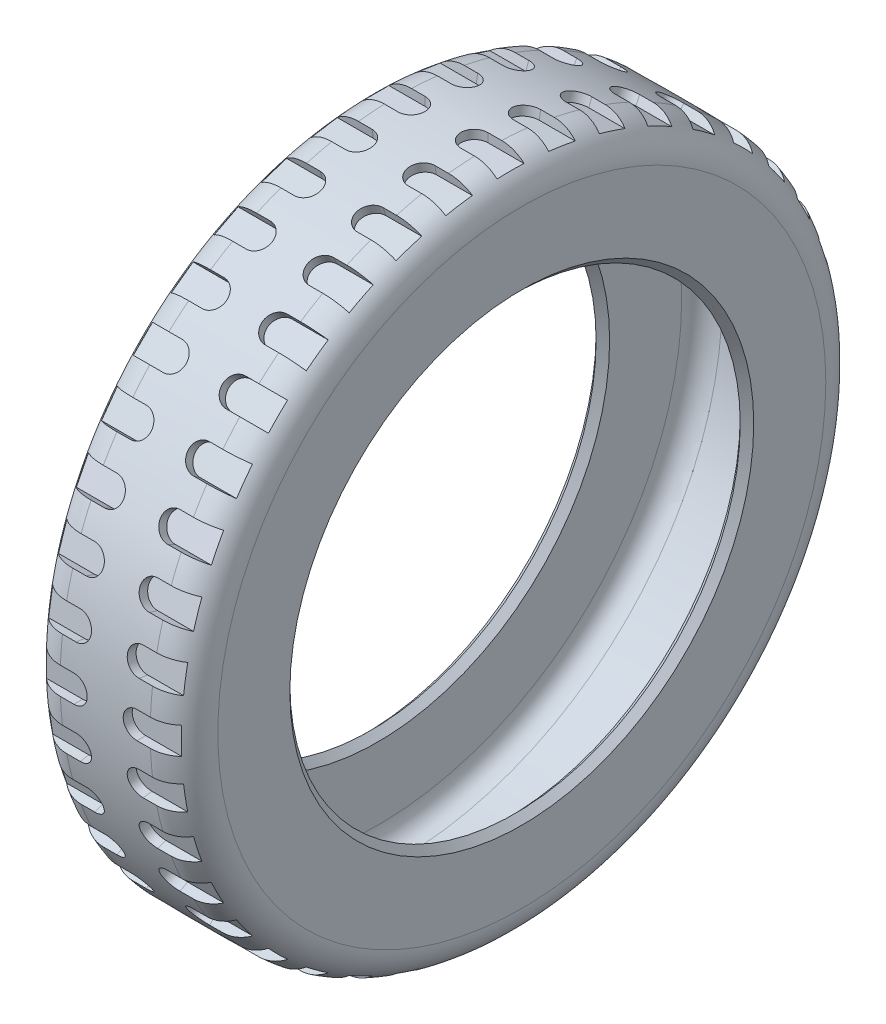
from build123d import *

# Parameters (mm, degrees)
CHAMFER1_SIZE         = 1.5
CUT_EXTRUDE1_DEPTH    = 2
CIRPATTERN1_COUNT     = 40
MIRROR1_COPY_1_DEPTH  = 2
MIRROR1_COPY_2_DEPTH  = 2
MIRROR1_COPY_3_DEPTH  = 2
MIRROR1_COPY_4_DEPTH  = 2
MIRROR1_COPY_5_DEPTH  = 2
MIRROR1_COPY_6_DEPTH  = 2
MIRROR1_COPY_7_DEPTH  = 2
MIRROR1_COPY_8_DEPTH  = 2
MIRROR1_COPY_9_DEPTH  = 2
MIRROR1_COPY_10_DEPTH = 2
MIRROR1_COPY_11_DEPTH = 2
MIRROR1_COPY_12_DEPTH = 2
MIRROR1_COPY_13_DEPTH = 2
MIRROR1_COPY_14_DEPTH = 2
MIRROR1_COPY_15_DEPTH = 2
MIRROR1_COPY_16_DEPTH = 2
MIRROR1_COPY_17_DEPTH = 2
MIRROR1_COPY_18_DEPTH = 2
MIRROR1_COPY_19_DEPTH = 2
MIRROR1_COPY_20_DEPTH = 2
MIRROR1_COPY_21_DEPTH = 2
MIRROR1_COPY_22_DEPTH = 2
MIRROR1_COPY_23_DEPTH = 2
MIRROR1_COPY_24_DEPTH = 2
MIRROR1_COPY_25_DEPTH = 2
MIRROR1_COPY_26_DEPTH = 2
MIRROR1_COPY_27_DEPTH = 2
MIRROR1_COPY_28_DEPTH = 2
MIRROR1_COPY_29_DEPTH = 2
MIRROR1_COPY_30_DEPTH = 2
MIRROR1_COPY_31_DEPTH = 2
MIRROR1_COPY_32_DEPTH = 2
MIRROR1_COPY_33_DEPTH = 2
MIRROR1_COPY_34_DEPTH = 2
MIRROR1_COPY_35_DEPTH = 2
MIRROR1_COPY_36_DEPTH = 2
MIRROR1_COPY_37_DEPTH = 2
MIRROR1_COPY_38_DEPTH = 2
MIRROR1_COPY_39_DEPTH = 2


with BuildPart() as part:
    # Sketch1 → Revolve1 (revolve)
    with BuildSketch(Plane.XY, mode=Mode.PRIVATE) as revolve1_sk:
        with BuildLine():
            Line((-14.5, 50), (-14.5, 67.5))
            ThreePointArc((-14.5, 67.5), (-13.181980515, 70.681980515), (-10, 72))
            Line((-10, 72), (10, 72))
            ThreePointArc((10, 72), (13.181980515, 70.681980515), (14.5, 67.5))
            Line((14.5, 67.5), (14.5, 50))
            Line((14.5, 50), (17.5, 50))
            Line((17.5, 50), (17.5, 67.5))
            ThreePointArc((17.5, 67.5), (15.303300859, 72.803300859), (10, 75))
            Line((10, 75), (-10, 75))
            ThreePointArc((-10, 75), (-15.303300859, 72.803300859), (-17.5, 67.5))
            Line((-17.5, 67.5), (-17.5, 50))
            Line((-17.5, 50), (-14.5, 50))
        make_face()
    revolve(revolve1_sk.sketch.rotate(Axis((0, 0, 0), (-1, 0, 0)), 90), axis=Axis((0, 0, 0), (-1, 0, 0)))

    # Chamfer1
    chamfer1_edges = [part.edges().sort_by_distance(p)[0] for p in [
        (14.5, 0, 50),
        (17.5, 0, 50),
        (-17.5, 0, 50),
        (-14.5, 0, 50),
    ]]
    chamfer(chamfer1_edges, length=CHAMFER1_SIZE - 0.0001)  # a hair under: the kernel refuses the full size

    # Sketch3 → Cut-Extrude1 (cut)
    with BuildSketch(Plane.XY.offset(75)):
        with BuildLine():
            Line((7, 3), (15, 3))
            Line((15, 3), (15, -3))
            Line((15, -3), (7, -3))
            ThreePointArc((7, -3), (4, 0), (7, 3))
        make_face()
    cut_extrude1 = extrude(amount=-CUT_EXTRUDE1_DEPTH, mode=Mode.SUBTRACT)

    # CirPattern1: Cut-Extrude1 ×40 about axis
    cirpattern1_axis = Axis((0, 0, 0), (1, 0, 0))
    for i in range(1, CIRPATTERN1_COUNT):
        add(cut_extrude1.rotate(cirpattern1_axis, i * 360 / CIRPATTERN1_COUNT), mode=Mode.SUBTRACT)

    # Mirror1: Cut-Extrude1 across plane
    add(cut_extrude1.mirror(Plane(origin=(0, 0, 0), x_dir=(0, 0, 1), z_dir=(1, 0, 0))), mode=Mode.SUBTRACT)

    # Mirror1 copy 1 sketch → Mirror1 copy 1 (cut)
    with BuildSketch(Plane(origin=(0, -11.732584878, 74.076625545), x_dir=(-1, 0, 0), z_dir=(0, -0.15643446504023087, 0.9876883405951378))):
        with BuildLine():
            Line((7, -3), (15, -3))
            Line((15, -3), (15, 3))
            Line((15, 3), (7, 3))
            ThreePointArc((7, 3), (4, 0), (7, -3))
        make_face()
    extrude(amount=-MIRROR1_COPY_1_DEPTH, mode=Mode.SUBTRACT)

    # Mirror1 copy 2 sketch → Mirror1 copy 2 (cut)
    with BuildSketch(Plane(origin=(0, -23.176274578, 71.329238722), x_dir=(-1, 0, 0), z_dir=(0, -0.3090169943749474, 0.9510565162951535))):
        with BuildLine():
            Line((7, -3), (15, -3))
            Line((15, -3), (15, 3))
            Line((15, 3), (7, 3))
            ThreePointArc((7, 3), (4, 0), (7, -3))
        make_face()
    extrude(amount=-MIRROR1_COPY_2_DEPTH, mode=Mode.SUBTRACT)

    # Mirror1 copy 3 sketch → Mirror1 copy 3 (cut)
    with BuildSketch(Plane(origin=(0, -34.04928748, 66.825489314), x_dir=(-1, 0, 0), z_dir=(0, -0.45399049973954675, 0.8910065241883679))):
        with BuildLine():
            Line((7, -3), (15, -3))
            Line((15, -3), (15, 3))
            Line((15, 3), (7, 3))
            ThreePointArc((7, 3), (4, 0), (7, -3))
        make_face()
    extrude(amount=-MIRROR1_COPY_3_DEPTH, mode=Mode.SUBTRACT)

    # Mirror1 copy 4 sketch → Mirror1 copy 4 (cut)
    with BuildSketch(Plane(origin=(0, -44.083893922, 60.676274578), x_dir=(-1, 0, 0), z_dir=(0, -0.5877852522924731, 0.8090169943749475))):
        with BuildLine():
            Line((7, -3), (15, -3))
            Line((15, -3), (15, 3))
            Line((15, 3), (7, 3))
            ThreePointArc((7, 3), (4, 0), (7, -3))
        make_face()
    extrude(amount=-MIRROR1_COPY_4_DEPTH, mode=Mode.SUBTRACT)

    # Mirror1 copy 5 sketch → Mirror1 copy 5 (cut)
    with BuildSketch(Plane(origin=(0, -53.033008589, 53.033008589), x_dir=(-1, 0, 0), z_dir=(0, -0.7071067811865475, 0.7071067811865476))):
        with BuildLine():
            Line((7, -3), (15, -3))
            Line((15, -3), (15, 3))
            Line((15, 3), (7, 3))
            ThreePointArc((7, 3), (4, 0), (7, -3))
        make_face()
    extrude(amount=-MIRROR1_COPY_5_DEPTH, mode=Mode.SUBTRACT)

    # Mirror1 copy 6 sketch → Mirror1 copy 6 (cut)
    with BuildSketch(Plane(origin=(0, -60.676274578, 44.083893922), x_dir=(-1, 0, 0), z_dir=(0, -0.8090169943749475, 0.5877852522924731))):
        with BuildLine():
            Line((7, -3), (15, -3))
            Line((15, -3), (15, 3))
            Line((15, 3), (7, 3))
            ThreePointArc((7, 3), (4, 0), (7, -3))
        make_face()
    extrude(amount=-MIRROR1_COPY_6_DEPTH, mode=Mode.SUBTRACT)

    # Mirror1 copy 7 sketch → Mirror1 copy 7 (cut)
    with BuildSketch(Plane(origin=(0, -66.825489314, 34.04928748), x_dir=(-1, 0, 0), z_dir=(0, -0.8910065241883678, 0.4539904997395468))):
        with BuildLine():
            Line((7, -3), (15, -3))
            Line((15, -3), (15, 3))
            Line((15, 3), (7, 3))
            ThreePointArc((7, 3), (4, 0), (7, -3))
        make_face()
    extrude(amount=-MIRROR1_COPY_7_DEPTH, mode=Mode.SUBTRACT)

    # Mirror1 copy 8 sketch → Mirror1 copy 8 (cut)
    with BuildSketch(Plane(origin=(0, -71.329238722, 23.176274578), x_dir=(-1, 0, 0), z_dir=(0, -0.9510565162951535, 0.30901699437494745))):
        with BuildLine():
            Line((7, -3), (15, -3))
            Line((15, -3), (15, 3))
            Line((15, 3), (7, 3))
            ThreePointArc((7, 3), (4, 0), (7, -3))
        make_face()
    extrude(amount=-MIRROR1_COPY_8_DEPTH, mode=Mode.SUBTRACT)

    # Mirror1 copy 9 sketch → Mirror1 copy 9 (cut)
    with BuildSketch(Plane(origin=(0, -74.076625545, 11.732584878), x_dir=(-1, 0, 0), z_dir=(0, -0.9876883405951378, 0.15643446504023092))):
        with BuildLine():
            Line((7, -3), (15, -3))
            Line((15, -3), (15, 3))
            Line((15, 3), (7, 3))
            ThreePointArc((7, 3), (4, 0), (7, -3))
        make_face()
    extrude(amount=-MIRROR1_COPY_9_DEPTH, mode=Mode.SUBTRACT)

    # Mirror1 copy 10 sketch → Mirror1 copy 10 (cut)
    with BuildSketch(Plane(origin=(0, -75, 0), x_dir=(-1, 0, 0), z_dir=(0, -1, 0))):
        with BuildLine():
            Line((7, -3), (15, -3))
            Line((15, -3), (15, 3))
            Line((15, 3), (7, 3))
            ThreePointArc((7, 3), (4, 0), (7, -3))
        make_face()
    extrude(amount=-MIRROR1_COPY_10_DEPTH, mode=Mode.SUBTRACT)

    # Mirror1 copy 11 sketch → Mirror1 copy 11 (cut)
    with BuildSketch(Plane(origin=(0, -74.076625545, -11.732584878), x_dir=(-1, 0, 0), z_dir=(0, -0.9876883405951378, -0.1564344650402308))):
        with BuildLine():
            Line((7, -3), (15, -3))
            Line((15, -3), (15, 3))
            Line((15, 3), (7, 3))
            ThreePointArc((7, 3), (4, 0), (7, -3))
        make_face()
    extrude(amount=-MIRROR1_COPY_11_DEPTH, mode=Mode.SUBTRACT)

    # Mirror1 copy 12 sketch → Mirror1 copy 12 (cut)
    with BuildSketch(Plane(origin=(0, -71.329238722, -23.176274578), x_dir=(-1, 0, 0), z_dir=(0, -0.9510565162951536, -0.30901699437494734))):
        with BuildLine():
            Line((7, -3), (15, -3))
            Line((15, -3), (15, 3))
            Line((15, 3), (7, 3))
            ThreePointArc((7, 3), (4, 0), (7, -3))
        make_face()
    extrude(amount=-MIRROR1_COPY_12_DEPTH, mode=Mode.SUBTRACT)

    # Mirror1 copy 13 sketch → Mirror1 copy 13 (cut)
    with BuildSketch(Plane(origin=(0, -66.825489314, -34.04928748), x_dir=(-1, 0, 0), z_dir=(0, -0.8910065241883679, -0.4539904997395467))):
        with BuildLine():
            Line((7, -3), (15, -3))
            Line((15, -3), (15, 3))
            Line((15, 3), (7, 3))
            ThreePointArc((7, 3), (4, 0), (7, -3))
        make_face()
    extrude(amount=-MIRROR1_COPY_13_DEPTH, mode=Mode.SUBTRACT)

    # Mirror1 copy 14 sketch → Mirror1 copy 14 (cut)
    with BuildSketch(Plane(origin=(0, -60.676274578, -44.083893922), x_dir=(-1, 0, 0), z_dir=(0, -0.8090169943749475, -0.587785252292473))):
        with BuildLine():
            Line((7, -3), (15, -3))
            Line((15, -3), (15, 3))
            Line((15, 3), (7, 3))
            ThreePointArc((7, 3), (4, 0), (7, -3))
        make_face()
    extrude(amount=-MIRROR1_COPY_14_DEPTH, mode=Mode.SUBTRACT)

    # Mirror1 copy 15 sketch → Mirror1 copy 15 (cut)
    with BuildSketch(Plane(origin=(0, -53.033008589, -53.033008589), x_dir=(-1, 0, 0), z_dir=(0, -0.7071067811865476, -0.7071067811865475))):
        with BuildLine():
            Line((7, -3), (15, -3))
            Line((15, -3), (15, 3))
            Line((15, 3), (7, 3))
            ThreePointArc((7, 3), (4, 0), (7, -3))
        make_face()
    extrude(amount=-MIRROR1_COPY_15_DEPTH, mode=Mode.SUBTRACT)

    # Mirror1 copy 16 sketch → Mirror1 copy 16 (cut)
    with BuildSketch(Plane(origin=(0, -44.083893922, -60.676274578), x_dir=(-1, 0, 0), z_dir=(0, -0.5877852522924732, -0.8090169943749473))):
        with BuildLine():
            Line((7, -3), (15, -3))
            Line((15, -3), (15, 3))
            Line((15, 3), (7, 3))
            ThreePointArc((7, 3), (4, 0), (7, -3))
        make_face()
    extrude(amount=-MIRROR1_COPY_16_DEPTH, mode=Mode.SUBTRACT)

    # Mirror1 copy 17 sketch → Mirror1 copy 17 (cut)
    with BuildSketch(Plane(origin=(0, -34.04928748, -66.825489314), x_dir=(-1, 0, 0), z_dir=(0, -0.45399049973954686, -0.8910065241883678))):
        with BuildLine():
            Line((7, -3), (15, -3))
            Line((15, -3), (15, 3))
            Line((15, 3), (7, 3))
            ThreePointArc((7, 3), (4, 0), (7, -3))
        make_face()
    extrude(amount=-MIRROR1_COPY_17_DEPTH, mode=Mode.SUBTRACT)

    # Mirror1 copy 18 sketch → Mirror1 copy 18 (cut)
    with BuildSketch(Plane(origin=(0, -23.176274578, -71.329238722), x_dir=(-1, 0, 0), z_dir=(0, -0.3090169943749475, -0.9510565162951535))):
        with BuildLine():
            Line((7, -3), (15, -3))
            Line((15, -3), (15, 3))
            Line((15, 3), (7, 3))
            ThreePointArc((7, 3), (4, 0), (7, -3))
        make_face()
    extrude(amount=-MIRROR1_COPY_18_DEPTH, mode=Mode.SUBTRACT)

    # Mirror1 copy 19 sketch → Mirror1 copy 19 (cut)
    with BuildSketch(Plane(origin=(0, -11.732584878, -74.076625545), x_dir=(-1, 0, 0), z_dir=(0, -0.15643446504023098, -0.9876883405951377))):
        with BuildLine():
            Line((7, -3), (15, -3))
            Line((15, -3), (15, 3))
            Line((15, 3), (7, 3))
            ThreePointArc((7, 3), (4, 0), (7, -3))
        make_face()
    extrude(amount=-MIRROR1_COPY_19_DEPTH, mode=Mode.SUBTRACT)

    # Mirror1 copy 20 sketch → Mirror1 copy 20 (cut)
    with BuildSketch(Plane(origin=(0, 0, -75), x_dir=(-1, 0, 0), z_dir=(0, 0, -1))):
        with BuildLine():
            Line((7, -3), (15, -3))
            Line((15, -3), (15, 3))
            Line((15, 3), (7, 3))
            ThreePointArc((7, 3), (4, 0), (7, -3))
        make_face()
    extrude(amount=-MIRROR1_COPY_20_DEPTH, mode=Mode.SUBTRACT)

    # Mirror1 copy 21 sketch → Mirror1 copy 21 (cut)
    with BuildSketch(Plane(origin=(0, 11.732584878, -74.076625545), x_dir=(-1, 0, 0), z_dir=(0, 0.15643446504023073, -0.9876883405951378))):
        with BuildLine():
            Line((7, -3), (15, -3))
            Line((15, -3), (15, 3))
            Line((15, 3), (7, 3))
            ThreePointArc((7, 3), (4, 0), (7, -3))
        make_face()
    extrude(amount=-MIRROR1_COPY_21_DEPTH, mode=Mode.SUBTRACT)

    # Mirror1 copy 22 sketch → Mirror1 copy 22 (cut)
    with BuildSketch(Plane(origin=(0, 23.176274578, -71.329238722), x_dir=(-1, 0, 0), z_dir=(0, 0.3090169943749473, -0.9510565162951536))):
        with BuildLine():
            Line((7, -3), (15, -3))
            Line((15, -3), (15, 3))
            Line((15, 3), (7, 3))
            ThreePointArc((7, 3), (4, 0), (7, -3))
        make_face()
    extrude(amount=-MIRROR1_COPY_22_DEPTH, mode=Mode.SUBTRACT)

    # Mirror1 copy 23 sketch → Mirror1 copy 23 (cut)
    with BuildSketch(Plane(origin=(0, 34.04928748, -66.825489314), x_dir=(-1, 0, 0), z_dir=(0, 0.4539904997395467, -0.8910065241883679))):
        with BuildLine():
            Line((7, -3), (15, -3))
            Line((15, -3), (15, 3))
            Line((15, 3), (7, 3))
            ThreePointArc((7, 3), (4, 0), (7, -3))
        make_face()
    extrude(amount=-MIRROR1_COPY_23_DEPTH, mode=Mode.SUBTRACT)

    # Mirror1 copy 24 sketch → Mirror1 copy 24 (cut)
    with BuildSketch(Plane(origin=(0, 44.083893922, -60.676274578), x_dir=(-1, 0, 0), z_dir=(0, 0.587785252292473, -0.8090169943749476))):
        with BuildLine():
            Line((7, -3), (15, -3))
            Line((15, -3), (15, 3))
            Line((15, 3), (7, 3))
            ThreePointArc((7, 3), (4, 0), (7, -3))
        make_face()
    extrude(amount=-MIRROR1_COPY_24_DEPTH, mode=Mode.SUBTRACT)

    # Mirror1 copy 25 sketch → Mirror1 copy 25 (cut)
    with BuildSketch(Plane(origin=(0, 53.033008589, -53.033008589), x_dir=(-1, 0, 0), z_dir=(0, 0.7071067811865475, -0.7071067811865477))):
        with BuildLine():
            Line((7, -3), (15, -3))
            Line((15, -3), (15, 3))
            Line((15, 3), (7, 3))
            ThreePointArc((7, 3), (4, 0), (7, -3))
        make_face()
    extrude(amount=-MIRROR1_COPY_25_DEPTH, mode=Mode.SUBTRACT)

    # Mirror1 copy 26 sketch → Mirror1 copy 26 (cut)
    with BuildSketch(Plane(origin=(0, 60.676274578, -44.083893922), x_dir=(-1, 0, 0), z_dir=(0, 0.8090169943749473, -0.5877852522924732))):
        with BuildLine():
            Line((7, -3), (15, -3))
            Line((15, -3), (15, 3))
            Line((15, 3), (7, 3))
            ThreePointArc((7, 3), (4, 0), (7, -3))
        make_face()
    extrude(amount=-MIRROR1_COPY_26_DEPTH, mode=Mode.SUBTRACT)

    # Mirror1 copy 27 sketch → Mirror1 copy 27 (cut)
    with BuildSketch(Plane(origin=(0, 66.825489314, -34.04928748), x_dir=(-1, 0, 0), z_dir=(0, 0.8910065241883678, -0.4539904997395469))):
        with BuildLine():
            Line((7, -3), (15, -3))
            Line((15, -3), (15, 3))
            Line((15, 3), (7, 3))
            ThreePointArc((7, 3), (4, 0), (7, -3))
        make_face()
    extrude(amount=-MIRROR1_COPY_27_DEPTH, mode=Mode.SUBTRACT)

    # Mirror1 copy 28 sketch → Mirror1 copy 28 (cut)
    with BuildSketch(Plane(origin=(0, 71.329238722, -23.176274578), x_dir=(-1, 0, 0), z_dir=(0, 0.9510565162951535, -0.30901699437494756))):
        with BuildLine():
            Line((7, -3), (15, -3))
            Line((15, -3), (15, 3))
            Line((15, 3), (7, 3))
            ThreePointArc((7, 3), (4, 0), (7, -3))
        make_face()
    extrude(amount=-MIRROR1_COPY_28_DEPTH, mode=Mode.SUBTRACT)

    # Mirror1 copy 29 sketch → Mirror1 copy 29 (cut)
    with BuildSketch(Plane(origin=(0, 74.076625545, -11.732584878), x_dir=(-1, 0, 0), z_dir=(0, 0.9876883405951377, -0.15643446504023104))):
        with BuildLine():
            Line((7, -3), (15, -3))
            Line((15, -3), (15, 3))
            Line((15, 3), (7, 3))
            ThreePointArc((7, 3), (4, 0), (7, -3))
        make_face()
    extrude(amount=-MIRROR1_COPY_29_DEPTH, mode=Mode.SUBTRACT)

    # Mirror1 copy 30 sketch → Mirror1 copy 30 (cut)
    with BuildSketch(Plane(origin=(0, 75, 0), x_dir=(-1, 0, 0), z_dir=(0, 1, 0))):
        with BuildLine():
            Line((7, -3), (15, -3))
            Line((15, -3), (15, 3))
            Line((15, 3), (7, 3))
            ThreePointArc((7, 3), (4, 0), (7, -3))
        make_face()
    extrude(amount=-MIRROR1_COPY_30_DEPTH, mode=Mode.SUBTRACT)

    # Mirror1 copy 31 sketch → Mirror1 copy 31 (cut)
    with BuildSketch(Plane(origin=(0, 74.076625545, 11.732584878), x_dir=(-1, 0, 0), z_dir=(0, 0.9876883405951378, 0.15643446504023067))):
        with BuildLine():
            Line((7, -3), (15, -3))
            Line((15, -3), (15, 3))
            Line((15, 3), (7, 3))
            ThreePointArc((7, 3), (4, 0), (7, -3))
        make_face()
    extrude(amount=-MIRROR1_COPY_31_DEPTH, mode=Mode.SUBTRACT)

    # Mirror1 copy 32 sketch → Mirror1 copy 32 (cut)
    with BuildSketch(Plane(origin=(0, 71.329238722, 23.176274578), x_dir=(-1, 0, 0), z_dir=(0, 0.9510565162951536, 0.30901699437494723))):
        with BuildLine():
            Line((7, -3), (15, -3))
            Line((15, -3), (15, 3))
            Line((15, 3), (7, 3))
            ThreePointArc((7, 3), (4, 0), (7, -3))
        make_face()
    extrude(amount=-MIRROR1_COPY_32_DEPTH, mode=Mode.SUBTRACT)

    # Mirror1 copy 33 sketch → Mirror1 copy 33 (cut)
    with BuildSketch(Plane(origin=(0, 66.825489314, 34.04928748), x_dir=(-1, 0, 0), z_dir=(0, 0.891006524188368, 0.45399049973954664))):
        with BuildLine():
            Line((7, -3), (15, -3))
            Line((15, -3), (15, 3))
            Line((15, 3), (7, 3))
            ThreePointArc((7, 3), (4, 0), (7, -3))
        make_face()
    extrude(amount=-MIRROR1_COPY_33_DEPTH, mode=Mode.SUBTRACT)

    # Mirror1 copy 34 sketch → Mirror1 copy 34 (cut)
    with BuildSketch(Plane(origin=(0, 60.676274578, 44.083893922), x_dir=(-1, 0, 0), z_dir=(0, 0.8090169943749476, 0.5877852522924729))):
        with BuildLine():
            Line((7, -3), (15, -3))
            Line((15, -3), (15, 3))
            Line((15, 3), (7, 3))
            ThreePointArc((7, 3), (4, 0), (7, -3))
        make_face()
    extrude(amount=-MIRROR1_COPY_34_DEPTH, mode=Mode.SUBTRACT)

    # Mirror1 copy 35 sketch → Mirror1 copy 35 (cut)
    with BuildSketch(Plane(origin=(0, 53.033008589, 53.033008589), x_dir=(-1, 0, 0), z_dir=(0, 0.7071067811865477, 0.7071067811865474))):
        with BuildLine():
            Line((7, -3), (15, -3))
            Line((15, -3), (15, 3))
            Line((15, 3), (7, 3))
            ThreePointArc((7, 3), (4, 0), (7, -3))
        make_face()
    extrude(amount=-MIRROR1_COPY_35_DEPTH, mode=Mode.SUBTRACT)

    # Mirror1 copy 36 sketch → Mirror1 copy 36 (cut)
    with BuildSketch(Plane(origin=(0, 44.083893922, 60.676274578), x_dir=(-1, 0, 0), z_dir=(0, 0.5877852522924734, 0.8090169943749473))):
        with BuildLine():
            Line((7, -3), (15, -3))
            Line((15, -3), (15, 3))
            Line((15, 3), (7, 3))
            ThreePointArc((7, 3), (4, 0), (7, -3))
        make_face()
    extrude(amount=-MIRROR1_COPY_36_DEPTH, mode=Mode.SUBTRACT)

    # Mirror1 copy 37 sketch → Mirror1 copy 37 (cut)
    with BuildSketch(Plane(origin=(0, 34.04928748, 66.825489314), x_dir=(-1, 0, 0), z_dir=(0, 0.45399049973954697, 0.8910065241883678))):
        with BuildLine():
            Line((7, -3), (15, -3))
            Line((15, -3), (15, 3))
            Line((15, 3), (7, 3))
            ThreePointArc((7, 3), (4, 0), (7, -3))
        make_face()
    extrude(amount=-MIRROR1_COPY_37_DEPTH, mode=Mode.SUBTRACT)

    # Mirror1 copy 38 sketch → Mirror1 copy 38 (cut)
    with BuildSketch(Plane(origin=(0, 23.176274578, 71.329238722), x_dir=(-1, 0, 0), z_dir=(0, 0.3090169943749476, 0.9510565162951535))):
        with BuildLine():
            Line((7, -3), (15, -3))
            Line((15, -3), (15, 3))
            Line((15, 3), (7, 3))
            ThreePointArc((7, 3), (4, 0), (7, -3))
        make_face()
    extrude(amount=-MIRROR1_COPY_38_DEPTH, mode=Mode.SUBTRACT)

    # Mirror1 copy 39 sketch → Mirror1 copy 39 (cut)
    with BuildSketch(Plane(origin=(0, 11.732584878, 74.076625545), x_dir=(-1, 0, 0), z_dir=(0, 0.15643446504023112, 0.9876883405951377))):
        with BuildLine():
            Line((7, -3), (15, -3))
            Line((15, -3), (15, 3))
            Line((15, 3), (7, 3))
            ThreePointArc((7, 3), (4, 0), (7, -3))
        make_face()
    extrude(amount=-MIRROR1_COPY_39_DEPTH, mode=Mode.SUBTRACT)


solid = part.part
